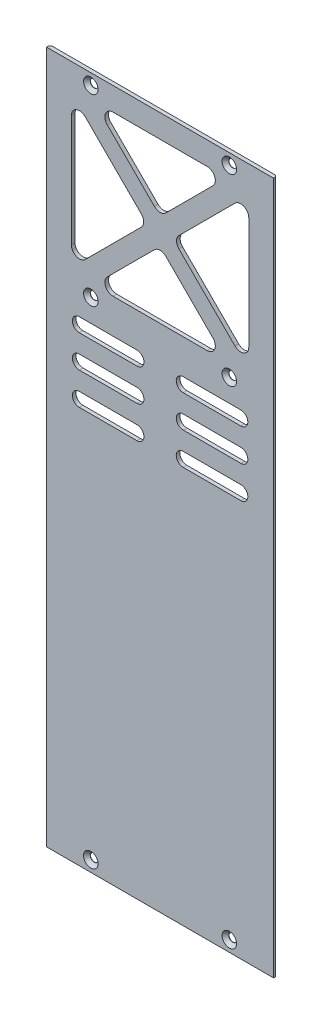
from build123d import *

# Parameters (mm, degrees)
SKETCH1_W                                       = 98.4125
SKETCH1_H                                       = 300
BOSS_EXTRUDE1_DEPTH                             = 0.79375
CHAMFER1_SIZE                                   = 0.79375
CUT_EXTRUDE1_DEPTH                              = 158.872654995
FILLET1_R                                       = 3.5
CSK_FOR_M3_FLAT_HEAD_MACHINE_SCREW1_D           = 3.4
CSK_FOR_M3_FLAT_HEAD_MACHINE_SCREW1_DEPTH       = 7.596
CSK_FOR_M3_FLAT_HEAD_MACHINE_SCREW1_CSINK_D     = 6.3
CSK_FOR_M3_FLAT_HEAD_MACHINE_SCREW1_CSINK_ANGLE = 90
CSK_FOR_M3_FLAT_HEAD_MACHINE_SCREW1_TIP         = 1.021463052


with BuildPart() as part:
    # Sketch1 → Boss-Extrude1 (new, symmetric)
    with BuildSketch(Plane.XY):
        Rectangle(SKETCH1_W, SKETCH1_H)
    extrude(amount=BOSS_EXTRUDE1_DEPTH, both=True)

    # Chamfer1
    chamfer1_edges = [part.edges().sort_by_distance(p)[0] for p in [
        (-49.20625, 0, -0.79375),
        (49.20625, 0, -0.79375),
    ]]
    chamfer(chamfer1_edges, length=CHAMFER1_SIZE)

    # Sketch2 → Cut-Extrude1 (cut, through all)
    with BuildSketch(Plane(origin=(0, 0, -0.79375), x_dir=(-1, 0, 0), z_dir=(0, 0, -1))):
        Polygon((-28.868145751, 140), (0, 111.131854249), (28.868145751, 140), align=None)
        Polygon((38.4125, 138.230645751), (5.656854249, 105.475), (38.4125, 72.719354249), align=None)
        Polygon((28.868145751, 70.95), (0, 99.818145751), (-28.868145751, 70.95), align=None)
        Polygon((-38.4125, 72.719354249), (-5.656854249, 105.475), (-38.4125, 138.230645751), align=None)
        with BuildLine():
            Line((-10, 55.95), (-35, 55.95))
            ThreePointArc((-35, 55.95), (-38, 52.95), (-35, 49.95))
            Line((-35, 49.95), (-10, 49.95))
            ThreePointArc((-10, 49.95), (-7, 52.95), (-10, 55.95))
        make_face()
        with BuildLine():
            Line((-10, 41.95), (-35, 41.95))
            ThreePointArc((-35, 41.95), (-38, 38.95), (-35, 35.95))
            Line((-35, 35.95), (-10, 35.95))
            ThreePointArc((-10, 35.95), (-7, 38.95), (-10, 41.95))
        make_face()
        with BuildLine():
            Line((-10, 27.95), (-35, 27.95))
            ThreePointArc((-35, 27.95), (-38, 24.95), (-35, 21.95))
            Line((-35, 21.95), (-10, 21.95))
            ThreePointArc((-10, 21.95), (-7, 24.95), (-10, 27.95))
        make_face()
        with BuildLine():
            Line((35, 55.95), (10, 55.95))
            ThreePointArc((10, 55.95), (7, 52.95), (10, 49.95))
            Line((10, 49.95), (35, 49.95))
            ThreePointArc((35, 49.95), (38, 52.95), (35, 55.95))
        make_face()
        with BuildLine():
            Line((35, 41.95), (10, 41.95))
            ThreePointArc((10, 41.95), (7, 38.95), (10, 35.95))
            Line((10, 35.95), (35, 35.95))
            ThreePointArc((35, 35.95), (38, 38.95), (35, 41.95))
        make_face()
        with BuildLine():
            Line((35, 27.95), (10, 27.95))
            ThreePointArc((10, 27.95), (7, 24.95), (10, 21.95))
            Line((10, 21.95), (35, 21.95))
            ThreePointArc((35, 21.95), (38, 24.95), (35, 27.95))
        make_face()
    extrude(amount=-CUT_EXTRUDE1_DEPTH, mode=Mode.SUBTRACT)

    # Fillet1
    fillet1_edges = [part.edges().sort_by_distance(p)[0] for p in [
        (-5.656854249, 105.475, 0),
        (-38.4125, 138.230645751, 0),
        (-28.868145751, 140, 0),
        (0, 111.131854249, 0),
        (28.868145751, 140, 0),
        (38.4125, 138.230645751, 0),
        (5.656854249, 105.475, 0),
        (-28.868145751, 70.95, 0),
        (0, 99.818145751, 0),
        (-38.4125, 72.719354249, 0),
        (28.868145751, 70.95, 0),
        (38.4125, 72.719354249, 0),
    ]]
    fillet(fillet1_edges, radius=FILLET1_R)

    # CSK for M3 Flat Head Machine Screw1
    with Locations(Plane.XY.offset(0.79375)):
        with Locations((-30, -145.225), (30, -145.225), (-30, 65.7), (30, 65.7), (30, 145.225), (-30, 145.225)):
            CounterSinkHole(CSK_FOR_M3_FLAT_HEAD_MACHINE_SCREW1_D / 2, CSK_FOR_M3_FLAT_HEAD_MACHINE_SCREW1_CSINK_D / 2, depth=CSK_FOR_M3_FLAT_HEAD_MACHINE_SCREW1_DEPTH, counter_sink_angle=CSK_FOR_M3_FLAT_HEAD_MACHINE_SCREW1_CSINK_ANGLE)
            with Locations((0, 0, -(CSK_FOR_M3_FLAT_HEAD_MACHINE_SCREW1_DEPTH + CSK_FOR_M3_FLAT_HEAD_MACHINE_SCREW1_TIP / 2))):  # 118° drill point
                Cone(0, CSK_FOR_M3_FLAT_HEAD_MACHINE_SCREW1_D / 2, CSK_FOR_M3_FLAT_HEAD_MACHINE_SCREW1_TIP, mode=Mode.SUBTRACT)


solid = part.part
